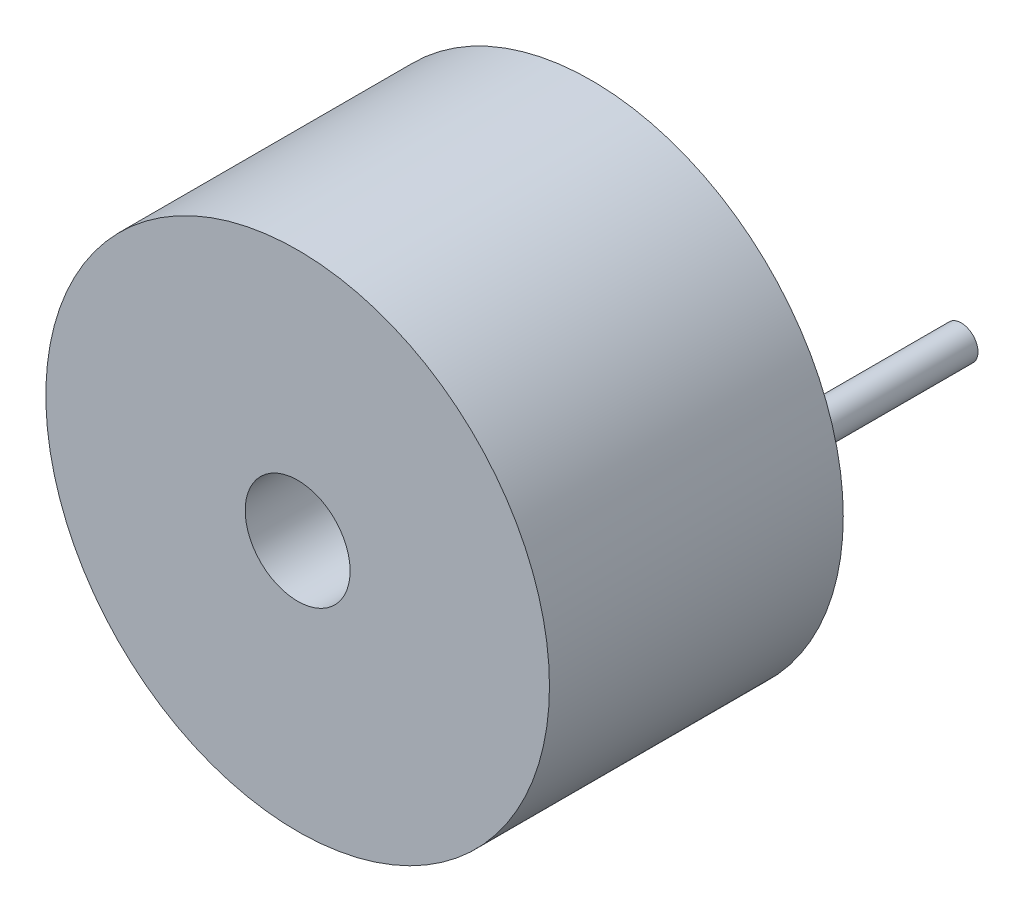
from build123d import *

# Parameters (mm, degrees)
SKETCH_1_R          = 6
EXTRUDE_1_DEPTH     = 7
SKETCH_2_R          = 0.4
EXTRUDE_2_DEPTH     = 5
SKETCH_3_R          = 1.25
CUT_EXTRUDE_1_DEPTH = 5


with BuildPart() as part:
    # 草图1 → 拉伸1 (new body)
    with BuildSketch(Plane.XY):
        Circle(SKETCH_1_R)
    extrude(amount=EXTRUDE_1_DEPTH)

    # 草图2 → 拉伸2 (add)
    with BuildSketch(Plane(origin=(0, 0, 0), x_dir=(-1, 0, 0), z_dir=(0, 0, -1))):
        with Locations((-3.81, 0)):
            Circle(SKETCH_2_R)
        with Locations((3.81, 0)):
            Circle(SKETCH_2_R)
    extrude(amount=EXTRUDE_2_DEPTH)

    # 草图3 → 切除-拉伸1 (cut)
    with BuildSketch(Plane.XY.offset(7)):
        Circle(SKETCH_3_R)
    extrude(amount=-CUT_EXTRUDE_1_DEPTH, mode=Mode.SUBTRACT)


solid = part.part
